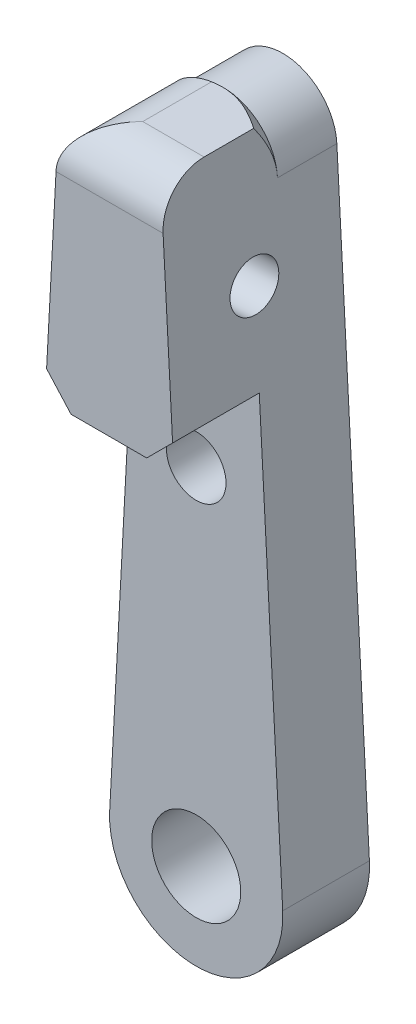
from build123d import *

# Parameters (mm, degrees)
BOSS_EXTRUDE1_DEPTH              = 6.35
F_0_257_DIAMETER_HOLE1_D         = 6.5278
F_11_64_0_17188_DIAMETER_HOLE2_D = 4.365752
BOSS_EXTRUDE2_DEPTH              = 6.35
CHAMFER1_SIZE                    = 2
CHAMFER1_SIZE_2                  = 1.900651734
F_9_64_0_14063_DIAMETER_HOLE3_D  = 3.572002
CUT_EXTRUDE6_DEPTH               = 1.27
CUT_EXTRUDE6_DEPTH_BACK          = 3.175
SKETCH37_W                       = 6.696
SKETCH37_H                       = 6.696
FILLET2_R                        = 3.175


with BuildPart() as part:
    # Sketch1 → Boss-Extrude1 (new body)
    with BuildSketch(Plane.XY):
        with BuildLine():
            Line((3.956679664, 44.662837486), (6.340832795, 0.341085714))
            ThreePointArc((6.340832795, 0.341085714), (0, -6.35), (-6.340832795, 0.341085714))
            Line((-6.340832795, 0.341085714), (-3.956679664, 44.662837486))
            ThreePointArc((-3.956679664, 44.662837486), (0, 48.4124), (3.956679664, 44.662837486))
        make_face()
    extrude(amount=BOSS_EXTRUDE1_DEPTH)

    # F (0.257) Diameter Hole1 (through all)
    with Locations(Plane.XY.offset(6.35)):
        with Locations((0, 0)):
            Hole(F_0_257_DIAMETER_HOLE1_D / 2)

    # 11/64 (0.17188) Diameter Hole2 (through all)
    with Locations(Plane.XY.offset(6.35)):
        with Locations((0, 25.4)):
            Hole(F_11_64_0_17188_DIAMETER_HOLE2_D / 2)

    # Sketch8 → Boss-Extrude2 (add)
    with BuildSketch(Plane.XY.offset(6.35)):
        Polygon((4.48049686, 34.925), (3.956679664, 44.662837486), (3.751732363, 48.472837486), (-3.751732363, 48.472837486), (-3.956679664, 44.662837486), (-4.48049686, 34.925), (-4.72151149, 30.44450314), (0, 30.44450314), (4.72151149, 30.44450314), align=None)
    extrude(amount=BOSS_EXTRUDE2_DEPTH)

    # Chamfer1
    # the kernel refuses this chamfer: 2, 1.900651734 mm, written as the material it adds along each edge
    with BuildSketch(Plane(origin=(0, 44.45, 6.35), x_dir=(-0.31887891485273423, -0.9477954619338197, 0), z_dir=(0.9477954619338197, -0.31887891485273423, 0))) as chamfer1_piece_1_section:
        Polygon((3.9624, CHAMFER1_SIZE), (3.9624 + CHAMFER1_SIZE, 0), (3.9624, 0), align=None)
    chamfer1_piece_1 = revolve(axis=Axis((0, 44.45, 6.35), (0, 0, -1)), revolution_arc=322.809720089, mode=Mode.PRIVATE)
    chamfer1_piece_1 = split(chamfer1_piece_1, bisect_by=Plane(origin=(-3.847302471, 46.696175344, 4.621548789), z_dir=(0.9985563456862132, -0.05371428571428559, 0)), keep=Keep.TOP, mode=Mode.PRIVATE)
    chamfer1_piece_1 = split(chamfer1_piece_1, bisect_by=Plane(origin=(3.826743256, 47.078374128, 4.621548789), z_dir=(-0.9985563456862132, -0.05371428571428527, 0)), keep=Keep.TOP, mode=Mode.PRIVATE)
    chamfer1_piece_1 = split(chamfer1_piece_1, bisect_by=Plane(origin=(-3.562844962, 48.472837486, 4.621548789), z_dir=(0, -1, 0)), keep=Keep.TOP, mode=Mode.PRIVATE)
    add(chamfer1_piece_1)
    # the kernel refuses this chamfer: 2, 1.900651734 mm, written as the material it takes off along each edge
    with BuildSketch(Plane(origin=(-4.72151149, 30.44450314, 6.35), x_dir=(0.026237795181529237, 0.9996557297910176, 0), z_dir=(0, 0, 1))) as chamfer1_2_piece_1:
        Polygon((CHAMFER1_SIZE * 0.999621916911, -CHAMFER1_SIZE * 0.0274958766106), (CHAMFER1_SIZE_2 * 0.0262377951788, -CHAMFER1_SIZE_2 * 0.999655729687), (0, 0), align=None)
    extrude(amount=11.493365976, mode=Mode.SUBTRACT)
    with BuildSketch(Plane(origin=(4.72151149, 30.44450314, 6.35), x_dir=(-0.023285655605869076, 0.9997288523609813, 0), z_dir=(0, 0, 1))) as chamfer1_2_piece_2:
        Polygon((CHAMFER1_SIZE_2 * 0.999536361745, CHAMFER1_SIZE_2 * 0.0304476820407), (CHAMFER1_SIZE * 0.0232856556059, CHAMFER1_SIZE * 0.999728852361), (0, 0), align=None)
    extrude(amount=11.493365976, mode=Mode.SUBTRACT)

    # 9/64 (0.14063) Diameter Hole3 (through all)
    with Locations(Plane(origin=(6.340832795, 0.341085714, 0), x_dir=(0, 0, -1), z_dir=(0.9985563456862132, 0.05371428571428528, 0))):
        with Locations((-6.35, 38.676337841)):
            Hole(F_9_64_0_14063_DIAMETER_HOLE3_D / 2)

    # Sketch37 → Cut-Extrude6 (cut, two sides: drawn at the far end of the back side and taken through both)
    with BuildSketch(Plane(origin=(-1.14098275, -0.061375679, 0), x_dir=(0, 0, -1), z_dir=(0.9985563456862132, 0.05371428571428528, 0)).offset(-CUT_EXTRUDE6_DEPTH_BACK)):
        with Locations((-6.35, 38.676337841)):
            Rectangle(SKETCH37_W, SKETCH37_H)
    extrude(amount=CUT_EXTRUDE6_DEPTH + CUT_EXTRUDE6_DEPTH_BACK, mode=Mode.SUBTRACT)

    # Fillet2
    fillet2_edges = [part.edges().sort_by_distance(p)[0] for p in [
        (-3.751732363, 48.472837486, 9.294196206),
        (0, 48.472837486, 12.7),
    ]]
    fillet(fillet2_edges, radius=FILLET2_R)


solid = part.part
